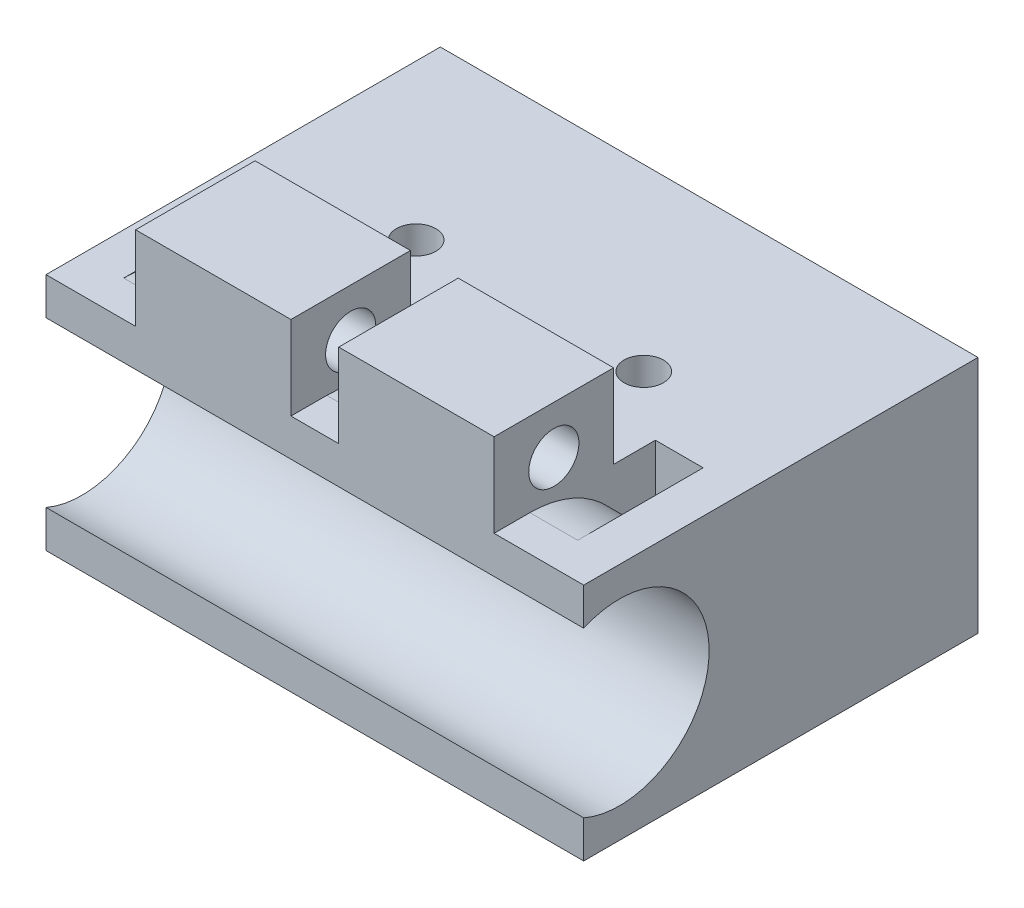
from build123d import *

# Parameters (mm, degrees)
SKETCH2_W                 = 45
SKETCH2_H                 = 20
BOSS_EXTRUDE1_DEPTH       = 33
SKETCH3_R                 = 7.5
CUT_EXTRUDE1_DEPTH        = 45
SKETCH4_R                 = 4
CUT_EXTRUDE2_DEPTH        = 10
SKETCH5_W                 = 4
SKETCH5_H                 = 1.5
CUT_EXTRUDE3_DEPTH        = 39
FILLET1_R                 = 9
M4X0_7_TAPPED_HOLE1_D     = 3.3
SKETCH8_W                 = 13
SKETCH8_H                 = 10
BOSS_EXTRUDE2_DEPTH       = 7
SKETCH14_R                = 2.1
CUT_EXTRUDE6_DEPTH        = 53.765992836
BODY_MOVE_COPY1_ANGLE     = 180
M3X0_5_TAPPED_HOLE1_D     = 2.5
M3X0_5_TAPPED_HOLE1_DEPTH = 7.5
M3X0_5_TAPPED_HOLE1_TIP   = 0.751075774


with BuildPart() as part:
    # Sketch2 → Boss-Extrude1 (new body)
    with BuildSketch(Plane.XY):
        Rectangle(SKETCH2_W, SKETCH2_H)
    extrude(amount=BOSS_EXTRUDE1_DEPTH)

    # Sketch3 → Cut-Extrude1 (cut)
    with BuildSketch(Plane(origin=(22.5, 0, 0), x_dir=(0, 0, -1), z_dir=(1, 0, 0))):
        with Locations((-30, 0)):
            Circle(SKETCH3_R)
    extrude(amount=-CUT_EXTRUDE1_DEPTH, mode=Mode.SUBTRACT)

    # Sketch4 → Cut-Extrude2 (cut)
    with BuildSketch(Plane(origin=(0, 0, 0), x_dir=(-1, 0, 0), z_dir=(0, 0, -1))):
        with Locations((-15, 0)):
            Circle(SKETCH4_R)
        with Locations((15, 0)):
            Circle(SKETCH4_R)
    extrude(amount=-CUT_EXTRUDE2_DEPTH, mode=Mode.SUBTRACT)

    # Sketch5 → Cut-Extrude3 (cut)
    with BuildSketch(Plane.XZ.offset(10)):
        with Locations((-17, 20.25)):
            Rectangle(SKETCH5_W, SKETCH5_H)
        with Locations((0, 20.25)):
            Rectangle(SKETCH5_W, SKETCH5_H)
        with Locations((17, 20.25)):
            Rectangle(SKETCH5_W, SKETCH5_H)
    extrude(amount=-CUT_EXTRUDE3_DEPTH, mode=Mode.SUBTRACT)

    # Fillet1
    fillet1_edges = [part.edges().sort_by_distance(p)[0] for p in [
        (17, -10, 21),
        (0, -10, 21),
        (-17, -10, 21),
    ]]
    fillet(fillet1_edges, radius=FILLET1_R)

    # M4x0.7 Tapped Hole1 (through all)
    with Locations(Plane(origin=(0, -10, 0), x_dir=(-1, 0, 0), z_dir=(0, -1, 0))):
        with Locations((-9.525, -15), (9.525, -15)):
            Hole(M4X0_7_TAPPED_HOLE1_D / 2)

    # Sketch8 → Boss-Extrude2 (add)
    with BuildSketch(Plane.XZ.offset(10)):
        with Locations((-8.5, 28)):
            Rectangle(SKETCH8_W, SKETCH8_H)
        with Locations((8.5, 28)):
            Rectangle(SKETCH8_W, SKETCH8_H)
    extrude(amount=BOSS_EXTRUDE2_DEPTH)

    # Sketch14 → Cut-Extrude6 (cut, through all)
    with BuildSketch(Plane.ZY.offset(15)):
        with Locations((28, -13)):
            Circle(SKETCH14_R)
    extrude(amount=-CUT_EXTRUDE6_DEPTH, mode=Mode.SUBTRACT)


with BuildPart() as part_1:
    # Body-Move/Copy1: moved
    add(part.part.rotate(Axis((0, -3.5, 0), (0, 0, 1)), BODY_MOVE_COPY1_ANGLE))

    # M3x0.5 Tapped Hole1
    with Locations(Plane(origin=(0, -17, 0), x_dir=(-1, 0, 0), z_dir=(0, -1, 0))):
        with Locations((9.525, -5), (-9.525, -5)):
            Hole(M3X0_5_TAPPED_HOLE1_D / 2, depth=M3X0_5_TAPPED_HOLE1_DEPTH)
            with Locations((0, 0, -(M3X0_5_TAPPED_HOLE1_DEPTH + M3X0_5_TAPPED_HOLE1_TIP / 2))):  # 118° drill point
                Cone(0, M3X0_5_TAPPED_HOLE1_D / 2, M3X0_5_TAPPED_HOLE1_TIP, mode=Mode.SUBTRACT)


solid = part_1.part
